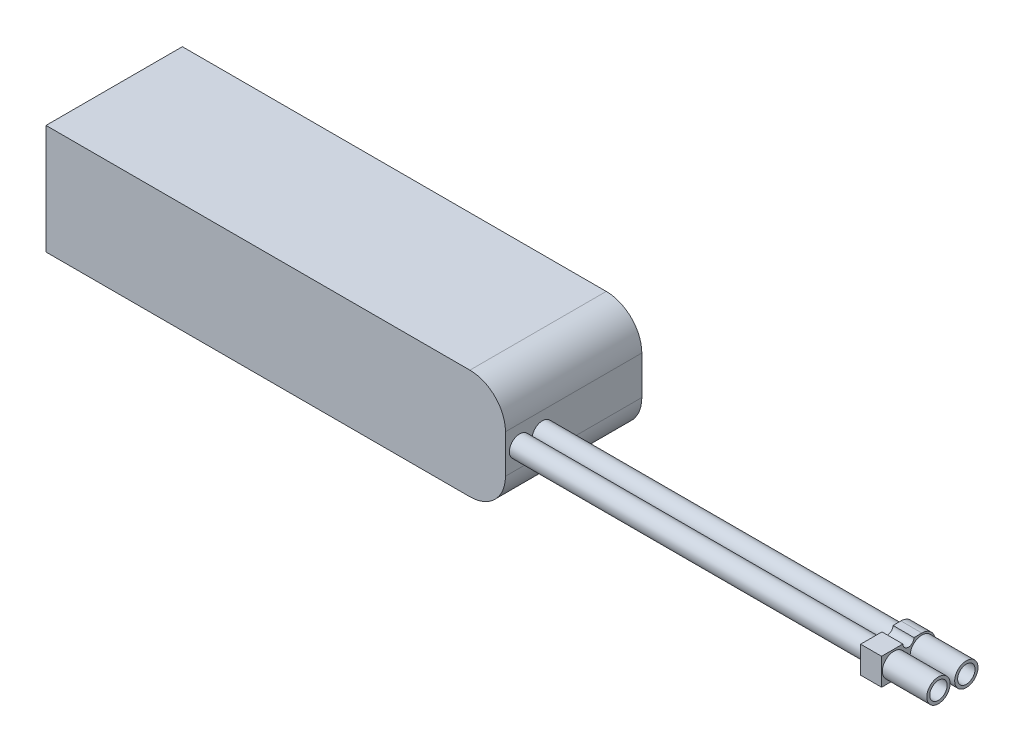
from build123d import *

# Parameters (mm, degrees)
CROQUIS4_W               = 155
CROQUIS4_H               = 37
SALIENTE_EXTRUIR3_DEPTH  = 23
REDONDEO1_R              = 12
CROQUIS6_R               = 3.484672525
SALIENTE_EXTRUIR4_DEPTH  = 120
SALIENTE_EXTRUIR8_DEPTH  = 7.07
CROQUIS12_R              = 3.474840626
SALIENTE_EXTRUIR9_DEPTH  = 123
CROQUIS14_R              = 3.935
CROQUIS14_R_2            = 2.935
SALIENTE_EXTRUIR10_DEPTH = 15


with BuildPart() as part:
    # Croquis4 → Saliente-Extruir3 (new, symmetric)
    with BuildSketch(Plane.XY):
        Rectangle(CROQUIS4_W, CROQUIS4_H)
    extrude(amount=SALIENTE_EXTRUIR3_DEPTH, both=True)

    # Redondeo1
    redondeo1_edges = [part.edges().sort_by_distance(p)[0] for p in [
        (77.5, -18.5, 0),
        (77.5, 18.5, 0),
    ]]
    fillet(redondeo1_edges, radius=REDONDEO1_R)

    # Croquis6 → Saliente-Extruir4 (add)
    with BuildSketch(Plane(origin=(77.5, 0, 0), x_dir=(0, 0, -1), z_dir=(1, 0, 0))):
        with Locations((-18.206269691, 0)):
            Circle(CROQUIS6_R)
    extrude(amount=SALIENTE_EXTRUIR4_DEPTH)

    # Croquis11 → Saliente-Extruir8 (add)
    with BuildSketch(Plane(origin=(197.5, 0, 0), x_dir=(0, 0, -1), z_dir=(1, 0, 0))):
        with BuildLine():
            Line((-23.185125142, 4.53), (-23.185125142, -4.53))
            Line((-23.185125142, -4.53), (-9.595125142, -4.53))
            ThreePointArc((-9.595125142, -4.53), (-5.065125142, 0), (-9.595125142, 4.53))
            Line((-9.595125142, 4.53), (-12.248737704, 4.53))
            ThreePointArc((-12.248737704, 4.53), (-14.125125142, 2.653612562), (-16.001512579, 4.53))
            Line((-16.001512579, 4.53), (-23.185125142, 4.53))
        make_face()
    extrude(amount=SALIENTE_EXTRUIR8_DEPTH)

    # Croquis12 → Saliente-Extruir9 (add)
    with BuildSketch(Plane(origin=(77.5, 0, 0), x_dir=(0, 0, -1), z_dir=(1, 0, 0))):
        with Locations((-10.529855547, 0)):
            Circle(CROQUIS12_R)
    extrude(amount=SALIENTE_EXTRUIR9_DEPTH)

    # Croquis14 → Saliente-Extruir10 (add)
    # profile 1 of 2: a face of its own
    with BuildSketch(Plane(origin=(204.57, 0, 0), x_dir=(0, 0, -1), z_dir=(1, 0, 0))):
        with Locations((-19, 0)):
            Circle(CROQUIS14_R)
        with Locations((-19, 0)):
            Circle(CROQUIS14_R_2, mode=Mode.SUBTRACT)
    # profile 2 of 2: a face of its own
    with BuildSketch(Plane(origin=(204.57, 0, 0), x_dir=(0, 0, -1), z_dir=(1, 0, 0))):
        with Locations((-9.595125142, 0)):
            Circle(CROQUIS14_R)
        with Locations((-9.595125142, 0)):
            Circle(CROQUIS14_R_2, mode=Mode.SUBTRACT)
    extrude(amount=SALIENTE_EXTRUIR10_DEPTH)


solid = part.part
